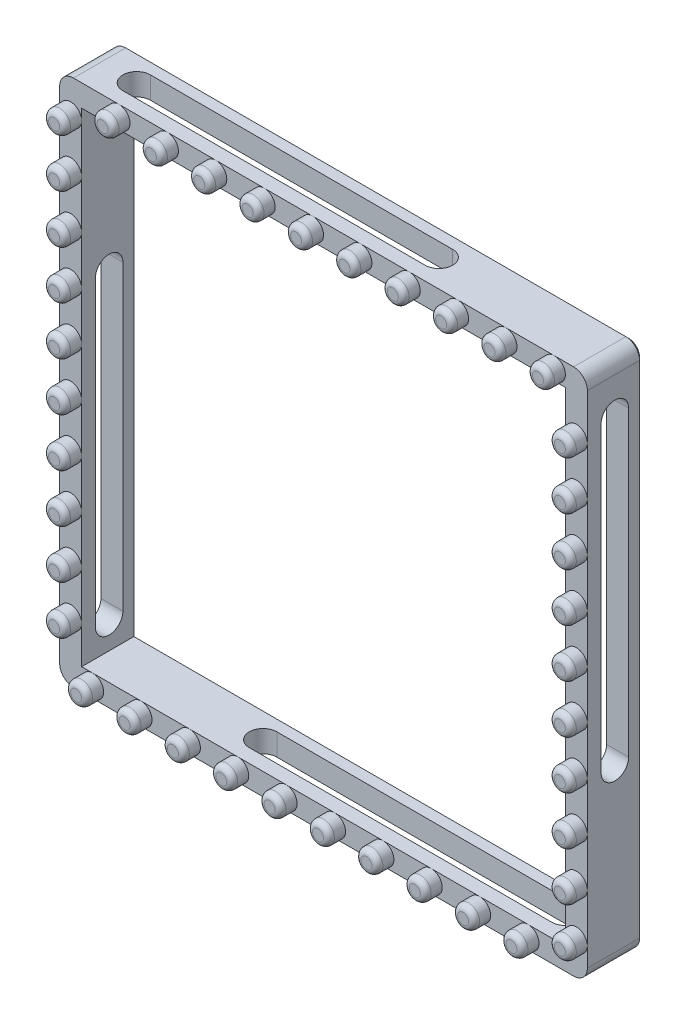
from build123d import *

# Parameters (mm, degrees)
SKETCH2_W                = 96
SKETCH2_H                = 96
SKETCH2_W_2              = 88
SKETCH2_H_2              = 88
BOSS_EXTRUDE1_DEPTH      = 10
CUT_EXTRUDE1_DEPTH       = 10
CIRPATTERN1_COUNT        = 4
FILLET1_R                = 2.5
SKETCH5_R                = 2
BOSS_EXTRUDE2_DEPTH      = 3
FILLET2_R                = 1
CIRPATTERN2_COUNT        = 4
FILLET2_OF_CIRPATTERN2_R = 1
SKETCH6_W                = 221.205641263
SKETCH6_H                = 210.929584578
CUT_EXTRUDE2_DEPTH       = 70.11584494
CHAMFER1_SIZE            = 0.5


# Read off the part's stored shape, not the designer's step: Mirror2
with BuildPart() as part:
    # Sketch2 → Boss-Extrude1 (new body)
    with BuildSketch(Plane.XY):
        Rectangle(SKETCH2_W, SKETCH2_H)
        Rectangle(SKETCH2_W_2, SKETCH2_H_2, mode=Mode.SUBTRACT)
    extrude(amount=BOSS_EXTRUDE1_DEPTH)

    # Sketch3 → Cut-Extrude1 (cut)
    with BuildSketch(Plane.XZ.offset(48)):
        with BuildLine():
            Line((-16, 7.5), (39, 7.5))
            ThreePointArc((39, 7.5), (41.5, 5), (39, 2.5))
            Line((39, 2.5), (-16, 2.5))
            ThreePointArc((-16, 2.5), (-18.5, 5), (-16, 7.5))
        make_face()
    cut_extrude1 = extrude(amount=-CUT_EXTRUDE1_DEPTH, mode=Mode.SUBTRACT)

    # CirPattern1: Cut-Extrude1 ×4 about axis
    cirpattern1_axis = Axis((0, 0, 0), (0, 0, 1))
    for i in range(1, CIRPATTERN1_COUNT):
        add(cut_extrude1.rotate(cirpattern1_axis, i * 360 / CIRPATTERN1_COUNT), mode=Mode.SUBTRACT)

    # Fillet1
    fillet1_edges = [part.edges().sort_by_distance(p)[0] for p in [
        (-48, 48, 5),
        (48, 48, 5),
        (48, -48, 5),
        (-48, -48, 5),
    ]]
    fillet(fillet1_edges, radius=FILLET1_R)

    # Sketch5 → Boss-Extrude2 (add)
    with BuildSketch(Plane(origin=(0, 0, 0), x_dir=(-1, 0, 0), z_dir=(0, 0, -1))):
        with Locations(Location((-42, 46, 0), (0, 0, 270))):
            Circle(SKETCH5_R)
        with Locations(Location((-33.2, 46, 0), (0, 0, 270))):
            Circle(SKETCH5_R)
        with Locations(Location((-24.4, 46, 0), (0, 0, 270))):
            Circle(SKETCH5_R)
        with Locations(Location((-15.6, 46, 0), (0, 0, 270))):
            Circle(SKETCH5_R)
        with Locations(Location((-6.8, 46, 0), (0, 0, 270))):
            Circle(SKETCH5_R)
        with Locations(Location((2, 46, 0), (0, 0, 270))):
            Circle(SKETCH5_R)
        with Locations(Location((10.8, 46, 0), (0, 0, 270))):
            Circle(SKETCH5_R)
        with Locations(Location((19.6, 46, 0), (0, 0, 270))):
            Circle(SKETCH5_R)
        with Locations(Location((28.4, 46, 0), (0, 0, 270))):
            Circle(SKETCH5_R)
        with Locations(Location((37.2, 46, 0), (0, 0, 270))):
            Circle(SKETCH5_R)
    boss_extrude2 = extrude(amount=BOSS_EXTRUDE2_DEPTH)

    # Fillet2
    fillet2_edges = [part.edges().sort_by_distance(p)[0] for p in [
        (42, 48, -3),
        (33.2, 48, -3),
        (24.4, 48, -3),
        (15.6, 48, -3),
        (6.8, 48, -3),
        (-2, 48, -3),
        (-10.8, 48, -3),
        (-19.6, 48, -3),
        (-28.4, 48, -3),
        (-37.2, 48, -3),
    ]]
    fillet(fillet2_edges, radius=FILLET2_R)

    # CirPattern2: Boss-Extrude2 ×4 about axis
    cirpattern2_axis = Axis((0, 0, 0), (0, 0, 1))
    for i in range(1, CIRPATTERN2_COUNT):
        add(boss_extrude2.rotate(cirpattern2_axis, i * 360 / CIRPATTERN2_COUNT))

    # Fillet2 of CirPattern2
    fillet2_of_cirpattern2_edges = [part.edges().sort_by_distance(p)[0] for p in [
        (-48, 42, -3),
        (-48, 33.2, -3),
        (-48, 24.4, -3),
        (-48, 15.6, -3),
        (-48, 6.8, -3),
        (-48, -2, -3),
        (-48, -10.8, -3),
        (-48, -19.6, -3),
        (-48, -28.4, -3),
        (-48, -37.2, -3),
        (-42, -48, -3),
        (-33.2, -48, -3),
        (-24.4, -48, -3),
        (-15.6, -48, -3),
        (-6.8, -48, -3),
        (2, -48, -3),
        (10.8, -48, -3),
        (19.6, -48, -3),
        (28.4, -48, -3),
        (37.2, -48, -3),
        (48, -42, -3),
        (48, -33.2, -3),
        (48, -24.4, -3),
        (48, -15.6, -3),
        (48, -6.8, -3),
        (48, 2, -3),
        (48, 10.8, -3),
        (48, 19.6, -3),
        (48, 28.4, -3),
        (48, 37.2, -3),
    ]]
    fillet(fillet2_of_cirpattern2_edges, radius=FILLET2_OF_CIRPATTERN2_R)

    # Mirror2 outline → Mirror2 (revolve)
    with BuildSketch(Plane(origin=(42, 46, 0), x_dir=(1, 0, 0), z_dir=(0, -1, 0))):
        with BuildLine():
            Line((2, 10), (2, 12))
            ThreePointArc((2, 12), (1.707106781, 12.707106781), (1, 13))
            Line((1, 13), (0, 13))
            Line((0, 13), (0, 10))
            Line((0, 10), (2, 10))
        make_face()
    revolve(axis=Axis((42, 46, 0), (0, 0, 1)))

    # Mirror2 2 outline → Mirror2 2 (revolve)
    with BuildSketch(Plane(origin=(33.2, 46, 0), x_dir=(1, 0, 0), z_dir=(0, -1, 0))):
        with BuildLine():
            Line((2, 10), (2, 12))
            ThreePointArc((2, 12), (1.707106781, 12.707106781), (1, 13))
            Line((1, 13), (0, 13))
            Line((0, 13), (0, 10))
            Line((0, 10), (2, 10))
        make_face()
    revolve(axis=Axis((33.2, 46, 0), (0, 0, 1)))

    # Mirror2 3 outline → Mirror2 3 (revolve)
    with BuildSketch(Plane(origin=(24.4, 46, 0), x_dir=(1, 0, 0), z_dir=(0, -1, 0))):
        with BuildLine():
            Line((2, 10), (2, 12))
            ThreePointArc((2, 12), (1.707106781, 12.707106781), (1, 13))
            Line((1, 13), (0, 13))
            Line((0, 13), (0, 10))
            Line((0, 10), (2, 10))
        make_face()
    revolve(axis=Axis((24.4, 46, 0), (0, 0, 1)))

    # Mirror2 4 outline → Mirror2 4 (revolve)
    with BuildSketch(Plane(origin=(15.6, 46, 0), x_dir=(1, 0, 0), z_dir=(0, -1, 0))):
        with BuildLine():
            Line((2, 10), (2, 12))
            ThreePointArc((2, 12), (1.707106781, 12.707106781), (1, 13))
            Line((1, 13), (0, 13))
            Line((0, 13), (0, 10))
            Line((0, 10), (2, 10))
        make_face()
    revolve(axis=Axis((15.6, 46, 0), (0, 0, 1)))

    # Mirror2 5 outline → Mirror2 5 (revolve)
    with BuildSketch(Plane(origin=(6.8, 46, 0), x_dir=(1, 0, 0), z_dir=(0, -1, 0))):
        with BuildLine():
            Line((2, 10), (2, 12))
            ThreePointArc((2, 12), (1.707106781, 12.707106781), (1, 13))
            Line((1, 13), (0, 13))
            Line((0, 13), (0, 10))
            Line((0, 10), (2, 10))
        make_face()
    revolve(axis=Axis((6.8, 46, 0), (0, 0, 1)))

    # Mirror2 6 outline → Mirror2 6 (revolve)
    with BuildSketch(Plane(origin=(-2, 46, 0), x_dir=(1, 0, 0), z_dir=(0, -1, 0))):
        with BuildLine():
            Line((2, 10), (2, 12))
            ThreePointArc((2, 12), (1.707106781, 12.707106781), (1, 13))
            Line((1, 13), (0, 13))
            Line((0, 13), (0, 10))
            Line((0, 10), (2, 10))
        make_face()
    revolve(axis=Axis((-2, 46, 0), (0, 0, 1)))

    # Mirror2 7 outline → Mirror2 7 (revolve)
    with BuildSketch(Plane(origin=(-10.8, 46, 0), x_dir=(1, 0, 0), z_dir=(0, -1, 0))):
        with BuildLine():
            Line((2, 10), (2, 12))
            ThreePointArc((2, 12), (1.707106781, 12.707106781), (1, 13))
            Line((1, 13), (0, 13))
            Line((0, 13), (0, 10))
            Line((0, 10), (2, 10))
        make_face()
    revolve(axis=Axis((-10.8, 46, 0), (0, 0, 1)))

    # Mirror2 8 outline → Mirror2 8 (revolve)
    with BuildSketch(Plane(origin=(-19.6, 46, 0), x_dir=(1, 0, 0), z_dir=(0, -1, 0))):
        with BuildLine():
            Line((2, 10), (2, 12))
            ThreePointArc((2, 12), (1.707106781, 12.707106781), (1, 13))
            Line((1, 13), (0, 13))
            Line((0, 13), (0, 10))
            Line((0, 10), (2, 10))
        make_face()
    revolve(axis=Axis((-19.6, 46, 0), (0, 0, 1)))

    # Mirror2 9 outline → Mirror2 9 (revolve)
    with BuildSketch(Plane(origin=(-28.4, 46, 0), x_dir=(1, 0, 0), z_dir=(0, -1, 0))):
        with BuildLine():
            Line((2, 10), (2, 12))
            ThreePointArc((2, 12), (1.707106781, 12.707106781), (1, 13))
            Line((1, 13), (0, 13))
            Line((0, 13), (0, 10))
            Line((0, 10), (2, 10))
        make_face()
    revolve(axis=Axis((-28.4, 46, 0), (0, 0, 1)))

    # Mirror2 10 outline → Mirror2 10 (revolve)
    with BuildSketch(Plane(origin=(-37.2, 46, 0), x_dir=(1, 0, 0), z_dir=(0, -1, 0))):
        with BuildLine():
            Line((2, 10), (2, 12))
            ThreePointArc((2, 12), (1.707106781, 12.707106781), (1, 13))
            Line((1, 13), (0, 13))
            Line((0, 13), (0, 10))
            Line((0, 10), (2, 10))
        make_face()
    revolve(axis=Axis((-37.2, 46, 0), (0, 0, 1)))

    # Mirror2 11 outline → Mirror2 11 (revolve)
    with BuildSketch(Plane(origin=(-46, 42, 0), x_dir=(1, 0, 0), z_dir=(0, -1, 0))):
        with BuildLine():
            Line((2, 10), (2, 12))
            ThreePointArc((2, 12), (1.707106781, 12.707106781), (1, 13))
            Line((1, 13), (0, 13))
            Line((0, 13), (0, 10))
            Line((0, 10), (2, 10))
        make_face()
    revolve(axis=Axis((-46, 42, 0), (0, 0, 1)))

    # Mirror2 12 outline → Mirror2 12 (revolve)
    with BuildSketch(Plane(origin=(-46, 33.2, 0), x_dir=(1, 0, 0), z_dir=(0, -1, 0))):
        with BuildLine():
            Line((2, 10), (2, 12))
            ThreePointArc((2, 12), (1.707106781, 12.707106781), (1, 13))
            Line((1, 13), (0, 13))
            Line((0, 13), (0, 10))
            Line((0, 10), (2, 10))
        make_face()
    revolve(axis=Axis((-46, 33.2, 0), (0, 0, 1)))

    # Mirror2 13 outline → Mirror2 13 (revolve)
    with BuildSketch(Plane(origin=(-46, 24.4, 0), x_dir=(1, 0, 0), z_dir=(0, -1, 0))):
        with BuildLine():
            Line((2, 10), (2, 12))
            ThreePointArc((2, 12), (1.707106781, 12.707106781), (1, 13))
            Line((1, 13), (0, 13))
            Line((0, 13), (0, 10))
            Line((0, 10), (2, 10))
        make_face()
    revolve(axis=Axis((-46, 24.4, 0), (0, 0, 1)))

    # Mirror2 14 outline → Mirror2 14 (revolve)
    with BuildSketch(Plane(origin=(-46, 15.6, 0), x_dir=(1, 0, 0), z_dir=(0, -1, 0))):
        with BuildLine():
            Line((2, 10), (2, 12))
            ThreePointArc((2, 12), (1.707106781, 12.707106781), (1, 13))
            Line((1, 13), (0, 13))
            Line((0, 13), (0, 10))
            Line((0, 10), (2, 10))
        make_face()
    revolve(axis=Axis((-46, 15.6, 0), (0, 0, 1)))

    # Mirror2 15 outline → Mirror2 15 (revolve)
    with BuildSketch(Plane(origin=(-46, 6.8, 0), x_dir=(1, 0, 0), z_dir=(0, -1, 0))):
        with BuildLine():
            Line((2, 10), (2, 12))
            ThreePointArc((2, 12), (1.707106781, 12.707106781), (1, 13))
            Line((1, 13), (0, 13))
            Line((0, 13), (0, 10))
            Line((0, 10), (2, 10))
        make_face()
    revolve(axis=Axis((-46, 6.8, 0), (0, 0, 1)))

    # Mirror2 16 outline → Mirror2 16 (revolve)
    with BuildSketch(Plane(origin=(-46, -2, 0), x_dir=(1, 0, 0), z_dir=(0, -1, 0))):
        with BuildLine():
            Line((2, 10), (2, 12))
            ThreePointArc((2, 12), (1.707106781, 12.707106781), (1, 13))
            Line((1, 13), (0, 13))
            Line((0, 13), (0, 10))
            Line((0, 10), (2, 10))
        make_face()
    revolve(axis=Axis((-46, -2, 0), (0, 0, 1)))

    # Mirror2 17 outline → Mirror2 17 (revolve)
    with BuildSketch(Plane(origin=(-46, -10.8, 0), x_dir=(1, 0, 0), z_dir=(0, -1, 0))):
        with BuildLine():
            Line((2, 10), (2, 12))
            ThreePointArc((2, 12), (1.707106781, 12.707106781), (1, 13))
            Line((1, 13), (0, 13))
            Line((0, 13), (0, 10))
            Line((0, 10), (2, 10))
        make_face()
    revolve(axis=Axis((-46, -10.8, 0), (0, 0, 1)))

    # Mirror2 18 outline → Mirror2 18 (revolve)
    with BuildSketch(Plane(origin=(-46, -19.6, 0), x_dir=(1, 0, 0), z_dir=(0, -1, 0))):
        with BuildLine():
            Line((2, 10), (2, 12))
            ThreePointArc((2, 12), (1.707106781, 12.707106781), (1, 13))
            Line((1, 13), (0, 13))
            Line((0, 13), (0, 10))
            Line((0, 10), (2, 10))
        make_face()
    revolve(axis=Axis((-46, -19.6, 0), (0, 0, 1)))

    # Mirror2 19 outline → Mirror2 19 (revolve)
    with BuildSketch(Plane(origin=(-46, -28.4, 0), x_dir=(1, 0, 0), z_dir=(0, -1, 0))):
        with BuildLine():
            Line((2, 10), (2, 12))
            ThreePointArc((2, 12), (1.707106781, 12.707106781), (1, 13))
            Line((1, 13), (0, 13))
            Line((0, 13), (0, 10))
            Line((0, 10), (2, 10))
        make_face()
    revolve(axis=Axis((-46, -28.4, 0), (0, 0, 1)))

    # Mirror2 20 outline → Mirror2 20 (revolve)
    with BuildSketch(Plane(origin=(-46, -37.2, 0), x_dir=(1, 0, 0), z_dir=(0, -1, 0))):
        with BuildLine():
            Line((2, 10), (2, 12))
            ThreePointArc((2, 12), (1.707106781, 12.707106781), (1, 13))
            Line((1, 13), (0, 13))
            Line((0, 13), (0, 10))
            Line((0, 10), (2, 10))
        make_face()
    revolve(axis=Axis((-46, -37.2, 0), (0, 0, 1)))

    # Mirror2 21 outline → Mirror2 21 (revolve)
    with BuildSketch(Plane(origin=(-42, -46, 0), x_dir=(1, 0, 0), z_dir=(0, -1, 0))):
        with BuildLine():
            Line((2, 10), (2, 12))
            ThreePointArc((2, 12), (1.707106781, 12.707106781), (1, 13))
            Line((1, 13), (0, 13))
            Line((0, 13), (0, 10))
            Line((0, 10), (2, 10))
        make_face()
    revolve(axis=Axis((-42, -46, 0), (0, 0, 1)))

    # Mirror2 22 outline → Mirror2 22 (revolve)
    with BuildSketch(Plane(origin=(-33.2, -46, 0), x_dir=(1, 0, 0), z_dir=(0, -1, 0))):
        with BuildLine():
            Line((2, 10), (2, 12))
            ThreePointArc((2, 12), (1.707106781, 12.707106781), (1, 13))
            Line((1, 13), (0, 13))
            Line((0, 13), (0, 10))
            Line((0, 10), (2, 10))
        make_face()
    revolve(axis=Axis((-33.2, -46, 0), (0, 0, 1)))

    # Mirror2 23 outline → Mirror2 23 (revolve)
    with BuildSketch(Plane(origin=(-24.4, -46, 0), x_dir=(1, 0, 0), z_dir=(0, -1, 0))):
        with BuildLine():
            Line((2, 10), (2, 12))
            ThreePointArc((2, 12), (1.707106781, 12.707106781), (1, 13))
            Line((1, 13), (0, 13))
            Line((0, 13), (0, 10))
            Line((0, 10), (2, 10))
        make_face()
    revolve(axis=Axis((-24.4, -46, 0), (0, 0, 1)))

    # Mirror2 24 outline → Mirror2 24 (revolve)
    with BuildSketch(Plane(origin=(-15.6, -46, 0), x_dir=(1, 0, 0), z_dir=(0, -1, 0))):
        with BuildLine():
            Line((2, 10), (2, 12))
            ThreePointArc((2, 12), (1.707106781, 12.707106781), (1, 13))
            Line((1, 13), (0, 13))
            Line((0, 13), (0, 10))
            Line((0, 10), (2, 10))
        make_face()
    revolve(axis=Axis((-15.6, -46, 0), (0, 0, 1)))

    # Mirror2 25 outline → Mirror2 25 (revolve)
    with BuildSketch(Plane(origin=(-6.8, -46, 0), x_dir=(1, 0, 0), z_dir=(0, -1, 0))):
        with BuildLine():
            Line((2, 10), (2, 12))
            ThreePointArc((2, 12), (1.707106781, 12.707106781), (1, 13))
            Line((1, 13), (0, 13))
            Line((0, 13), (0, 10))
            Line((0, 10), (2, 10))
        make_face()
    revolve(axis=Axis((-6.8, -46, 0), (0, 0, 1)))

    # Mirror2 26 outline → Mirror2 26 (revolve)
    with BuildSketch(Plane(origin=(2, -46, 0), x_dir=(1, 0, 0), z_dir=(0, -1, 0))):
        with BuildLine():
            Line((2, 10), (2, 12))
            ThreePointArc((2, 12), (1.707106781, 12.707106781), (1, 13))
            Line((1, 13), (0, 13))
            Line((0, 13), (0, 10))
            Line((0, 10), (2, 10))
        make_face()
    revolve(axis=Axis((2, -46, 0), (0, 0, 1)))

    # Mirror2 27 outline → Mirror2 27 (revolve)
    with BuildSketch(Plane(origin=(10.8, -46, 0), x_dir=(1, 0, 0), z_dir=(0, -1, 0))):
        with BuildLine():
            Line((2, 10), (2, 12))
            ThreePointArc((2, 12), (1.707106781, 12.707106781), (1, 13))
            Line((1, 13), (0, 13))
            Line((0, 13), (0, 10))
            Line((0, 10), (2, 10))
        make_face()
    revolve(axis=Axis((10.8, -46, 0), (0, 0, 1)))

    # Mirror2 28 outline → Mirror2 28 (revolve)
    with BuildSketch(Plane(origin=(19.6, -46, 0), x_dir=(1, 0, 0), z_dir=(0, -1, 0))):
        with BuildLine():
            Line((2, 10), (2, 12))
            ThreePointArc((2, 12), (1.707106781, 12.707106781), (1, 13))
            Line((1, 13), (0, 13))
            Line((0, 13), (0, 10))
            Line((0, 10), (2, 10))
        make_face()
    revolve(axis=Axis((19.6, -46, 0), (0, 0, 1)))

    # Mirror2 29 outline → Mirror2 29 (revolve)
    with BuildSketch(Plane(origin=(28.4, -46, 0), x_dir=(1, 0, 0), z_dir=(0, -1, 0))):
        with BuildLine():
            Line((2, 10), (2, 12))
            ThreePointArc((2, 12), (1.707106781, 12.707106781), (1, 13))
            Line((1, 13), (0, 13))
            Line((0, 13), (0, 10))
            Line((0, 10), (2, 10))
        make_face()
    revolve(axis=Axis((28.4, -46, 0), (0, 0, 1)))

    # Mirror2 30 outline → Mirror2 30 (revolve)
    with BuildSketch(Plane(origin=(37.2, -46, 0), x_dir=(1, 0, 0), z_dir=(0, -1, 0))):
        with BuildLine():
            Line((2, 10), (2, 12))
            ThreePointArc((2, 12), (1.707106781, 12.707106781), (1, 13))
            Line((1, 13), (0, 13))
            Line((0, 13), (0, 10))
            Line((0, 10), (2, 10))
        make_face()
    revolve(axis=Axis((37.2, -46, 0), (0, 0, 1)))

    # Mirror2 31 outline → Mirror2 31 (revolve)
    with BuildSketch(Plane(origin=(46, -42, 0), x_dir=(1, 0, 0), z_dir=(0, -1, 0))):
        with BuildLine():
            Line((2, 10), (2, 12))
            ThreePointArc((2, 12), (1.707106781, 12.707106781), (1, 13))
            Line((1, 13), (0, 13))
            Line((0, 13), (0, 10))
            Line((0, 10), (2, 10))
        make_face()
    revolve(axis=Axis((46, -42, 0), (0, 0, 1)))

    # Mirror2 32 outline → Mirror2 32 (revolve)
    with BuildSketch(Plane(origin=(46, -33.2, 0), x_dir=(1, 0, 0), z_dir=(0, -1, 0))):
        with BuildLine():
            Line((2, 10), (2, 12))
            ThreePointArc((2, 12), (1.707106781, 12.707106781), (1, 13))
            Line((1, 13), (0, 13))
            Line((0, 13), (0, 10))
            Line((0, 10), (2, 10))
        make_face()
    revolve(axis=Axis((46, -33.2, 0), (0, 0, 1)))

    # Mirror2 33 outline → Mirror2 33 (revolve)
    with BuildSketch(Plane(origin=(46, -24.4, 0), x_dir=(1, 0, 0), z_dir=(0, -1, 0))):
        with BuildLine():
            Line((2, 10), (2, 12))
            ThreePointArc((2, 12), (1.707106781, 12.707106781), (1, 13))
            Line((1, 13), (0, 13))
            Line((0, 13), (0, 10))
            Line((0, 10), (2, 10))
        make_face()
    revolve(axis=Axis((46, -24.4, 0), (0, 0, 1)))

    # Mirror2 34 outline → Mirror2 34 (revolve)
    with BuildSketch(Plane(origin=(46, -15.6, 0), x_dir=(1, 0, 0), z_dir=(0, -1, 0))):
        with BuildLine():
            Line((2, 10), (2, 12))
            ThreePointArc((2, 12), (1.707106781, 12.707106781), (1, 13))
            Line((1, 13), (0, 13))
            Line((0, 13), (0, 10))
            Line((0, 10), (2, 10))
        make_face()
    revolve(axis=Axis((46, -15.6, 0), (0, 0, 1)))

    # Mirror2 35 outline → Mirror2 35 (revolve)
    with BuildSketch(Plane(origin=(46, -6.8, 0), x_dir=(1, 0, 0), z_dir=(0, -1, 0))):
        with BuildLine():
            Line((2, 10), (2, 12))
            ThreePointArc((2, 12), (1.707106781, 12.707106781), (1, 13))
            Line((1, 13), (0, 13))
            Line((0, 13), (0, 10))
            Line((0, 10), (2, 10))
        make_face()
    revolve(axis=Axis((46, -6.8, 0), (0, 0, 1)))

    # Mirror2 36 outline → Mirror2 36 (revolve)
    with BuildSketch(Plane(origin=(46, 2, 0), x_dir=(1, 0, 0), z_dir=(0, -1, 0))):
        with BuildLine():
            Line((2, 10), (2, 12))
            ThreePointArc((2, 12), (1.707106781, 12.707106781), (1, 13))
            Line((1, 13), (0, 13))
            Line((0, 13), (0, 10))
            Line((0, 10), (2, 10))
        make_face()
    revolve(axis=Axis((46, 2, 0), (0, 0, 1)))

    # Mirror2 37 outline → Mirror2 37 (revolve)
    with BuildSketch(Plane(origin=(46, 10.8, 0), x_dir=(1, 0, 0), z_dir=(0, -1, 0))):
        with BuildLine():
            Line((2, 10), (2, 12))
            ThreePointArc((2, 12), (1.707106781, 12.707106781), (1, 13))
            Line((1, 13), (0, 13))
            Line((0, 13), (0, 10))
            Line((0, 10), (2, 10))
        make_face()
    revolve(axis=Axis((46, 10.8, 0), (0, 0, 1)))

    # Mirror2 38 outline → Mirror2 38 (revolve)
    with BuildSketch(Plane(origin=(46, 19.6, 0), x_dir=(1, 0, 0), z_dir=(0, -1, 0))):
        with BuildLine():
            Line((2, 10), (2, 12))
            ThreePointArc((2, 12), (1.707106781, 12.707106781), (1, 13))
            Line((1, 13), (0, 13))
            Line((0, 13), (0, 10))
            Line((0, 10), (2, 10))
        make_face()
    revolve(axis=Axis((46, 19.6, 0), (0, 0, 1)))

    # Mirror2 39 outline → Mirror2 39 (revolve)
    with BuildSketch(Plane(origin=(46, 28.4, 0), x_dir=(1, 0, 0), z_dir=(0, -1, 0))):
        with BuildLine():
            Line((2, 10), (2, 12))
            ThreePointArc((2, 12), (1.707106781, 12.707106781), (1, 13))
            Line((1, 13), (0, 13))
            Line((0, 13), (0, 10))
            Line((0, 10), (2, 10))
        make_face()
    revolve(axis=Axis((46, 28.4, 0), (0, 0, 1)))

    # Mirror2 40 outline → Mirror2 40 (revolve)
    with BuildSketch(Plane(origin=(46, 37.2, 0), x_dir=(1, 0, 0), z_dir=(0, -1, 0))):
        with BuildLine():
            Line((2, 10), (2, 12))
            ThreePointArc((2, 12), (1.707106781, 12.707106781), (1, 13))
            Line((1, 13), (0, 13))
            Line((0, 13), (0, 10))
            Line((0, 10), (2, 10))
        make_face()
    revolve(axis=Axis((46, 37.2, 0), (0, 0, 1)))

    # Sketch6 → Cut-Extrude2 (cut, through all)
    with BuildSketch(Plane(origin=(0, 0, 0), x_dir=(-1, 0, 0), z_dir=(0, 0, -1))):
        with Locations((-55.959015951, 53.340424325)):
            Rectangle(SKETCH6_W, SKETCH6_H)
    extrude(amount=CUT_EXTRUDE2_DEPTH, mode=Mode.SUBTRACT)

    # Chamfer1
    chamfer1_edges = [part.edges().sort_by_distance(p)[0] for p in [
        (0, 48, 0),
        (-48, 0, 0),
        (48, 0, 0),
        (0, -48, 0),
        (-47.267766953, 47.267766953, 0),
        (-47.267766953, -47.267766953, 0),
        (47.267766953, -47.267766953, 0),
        (47.267766953, 47.267766953, 0),
        (44, 0, 0),
        (0, 44, 0),
        (-44, 0, 0),
        (0, -44, 0),
    ]]
    chamfer(chamfer1_edges, length=CHAMFER1_SIZE)


solid = part.part
